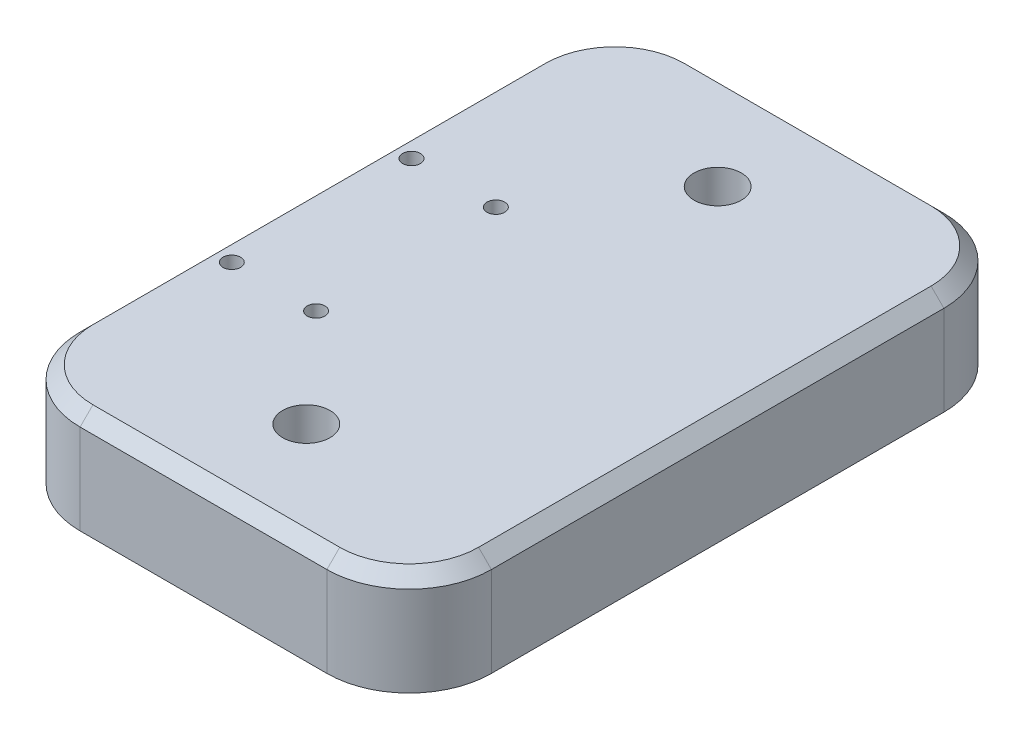
from build123d import *

# Parameters (mm, degrees)
SKETCH1_W           = 76.2
SKETCH1_H           = 12.7
BOSS_EXTRUDE1_DEPTH = 50.8
SKETCH3_R           = 1.0922
SKETCH3_R_2         = 2.921
CUT_EXTRUDE2_DEPTH  = 93.457395594
FILLET1_R           = 10.16
CHAMFER1_SIZE       = 1.5875


with BuildPart() as part:
    # Sketch1 → Boss-Extrude1 (new body)
    with BuildSketch(Plane(origin=(0, 0, 0), x_dir=(0, 0, -1), z_dir=(1, 0, 0))):
        with Locations((38.1, 6.35)):
            Rectangle(SKETCH1_W, SKETCH1_H)
    extrude(amount=BOSS_EXTRUDE1_DEPTH)

    # Sketch3 → Cut-Extrude2 (cut, through all)
    with BuildSketch(Plane.XZ):
        with Locations((13.9065, -25.4)):
            Circle(SKETCH3_R)
        with Locations((25.4, -63.5)):
            Circle(SKETCH3_R_2)
        with Locations((25.4, -12.7)):
            Circle(SKETCH3_R_2)
        with Locations((3.4925, -25.4)):
            Circle(SKETCH3_R)
        with Locations((3.4925, -47.5996)):
            Circle(SKETCH3_R)
        with Locations((13.9065, -47.5996)):
            Circle(SKETCH3_R)
    extrude(amount=-CUT_EXTRUDE2_DEPTH, mode=Mode.SUBTRACT)

    # Fillet1
    fillet1_edges = [part.edges().sort_by_distance(p)[0] for p in [
        (0, 6.35, 0),
        (50.8, 6.35, 0),
        (0, 6.35, -76.2),
        (50.8, 6.35, -76.2),
    ]]
    fillet(fillet1_edges, radius=FILLET1_R)

    # Chamfer1
    chamfer1_edges = [part.edges().sort_by_distance(p)[0] for p in [
        (0, 12.7, -38.1),
        (2.975795103, 12.7, -2.975795103),
        (25.4, 12.7, 0),
        (47.824204897, 12.7, -2.975795103),
        (50.8, 12.7, -38.1),
        (47.824204897, 12.7, -73.224204897),
        (25.4, 12.7, -76.2),
        (2.975795103, 12.7, -73.224204897),
    ]]
    chamfer(chamfer1_edges, length=CHAMFER1_SIZE)


solid = part.part
